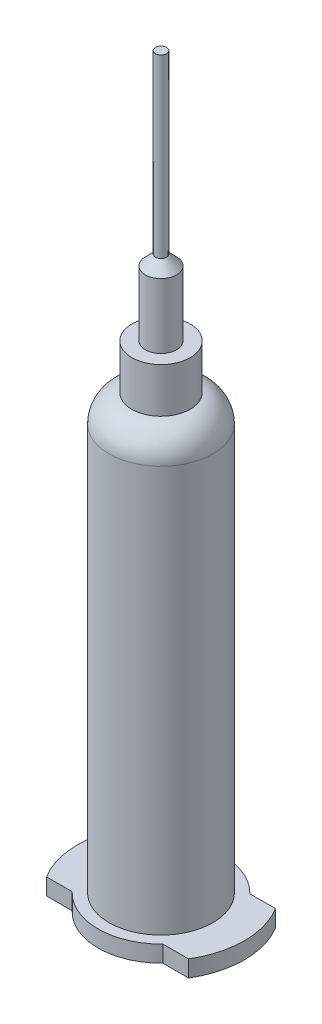
from build123d import *

# Parameters (mm, degrees)
FILLET1_R          = 5
CUT_EXTRUDE1_START = -3
CUT_EXTRUDE1_DEPTH = 3
SKETCH4_R          = 7.925
CUT_EXTRUDE2_DEPTH = 20


with BuildPart() as part:
    # Sketch2 → Revolve1 (revolve)
    with BuildSketch(Plane.XY, mode=Mode.PRIVATE) as revolve1_sk:
        Polygon((15.075, -67.5), (0, -67.5), (0, 67.5), (1, 67.5), (1, 35.6), (2.825, 33.749724479), (2.825, 22), (5.275, 22), (5.275, 13.9), (9.4, 13.9), (9.4, -64.5), (15.075, -64.5), align=None)
    revolve(revolve1_sk.sketch.rotate(Axis((0, 24.52235385, 0), (0, -1, 0)), 90), axis=Axis((0, 24.52235385, 0), (0, -1, 0)))

    # Fillet1
    # the kernel refuses this fillet: 5 mm, written as the material it takes off along each edge
    with BuildSketch(Plane(origin=(0, 13.9, 0), x_dir=(0, 0, 1), z_dir=(1, 0, 0))) as fillet1_piece_1:
        with BuildLine():
            CenterArc((4.4, 4.922842167), FILLET1_R, 280.078658108, 79.921341892)
            Line((9.4, 4.922842167), (9.5, 4.922842167))
            Line((9.5, 4.922842167), (9.5, 0))
            Line((9.5, 0), (9.4, -0.1))
            ThreePointArc((9.4, -0.1), (7.3375, -0.1), (5.2925, -0.098456843))
            Line((5.2925, -0.098456843), (5.275, 0))
        make_face()
    revolve(axis=Axis((0, 13.9, 0), (0, -1, 0)), mode=Mode.SUBTRACT)

    # Sketch3 → Cut-Extrude1 (cut)
    with BuildSketch(Plane(origin=(0, -64.5, 0), x_dir=(1, 0, 0), z_dir=(0, 1, 0)).offset(CUT_EXTRUDE1_START)):
        with BuildLine():
            Line((-12.854571171, 7.875), (-8.20822758, 7.875))
            ThreePointArc((-8.20822758, 7.875), (0, 11.375), (8.20822758, 7.875))
            Line((8.20822758, 7.875), (12.854571171, 7.875))
            ThreePointArc((12.854571171, 7.875), (0, 15.075), (-12.854571171, 7.875))
        make_face()
        with BuildLine():
            Line((-12.854571171, -7.875), (-8.20822758, -7.875))
            ThreePointArc((-8.20822758, -7.875), (0, -11.375), (8.20822758, -7.875))
            Line((8.20822758, -7.875), (12.854571171, -7.875))
            ThreePointArc((12.854571171, -7.875), (0, -15.075), (-12.854571171, -7.875))
        make_face()
    extrude(amount=CUT_EXTRUDE1_DEPTH, mode=Mode.SUBTRACT)

    # Sketch4 → Cut-Extrude2 (cut)
    with BuildSketch(Plane.XZ.offset(67.5)):
        with Locations(Location((0, 0, 0), (0, 0, 270))):
            Circle(SKETCH4_R)
    extrude(amount=-CUT_EXTRUDE2_DEPTH, mode=Mode.SUBTRACT)


solid = part.part
